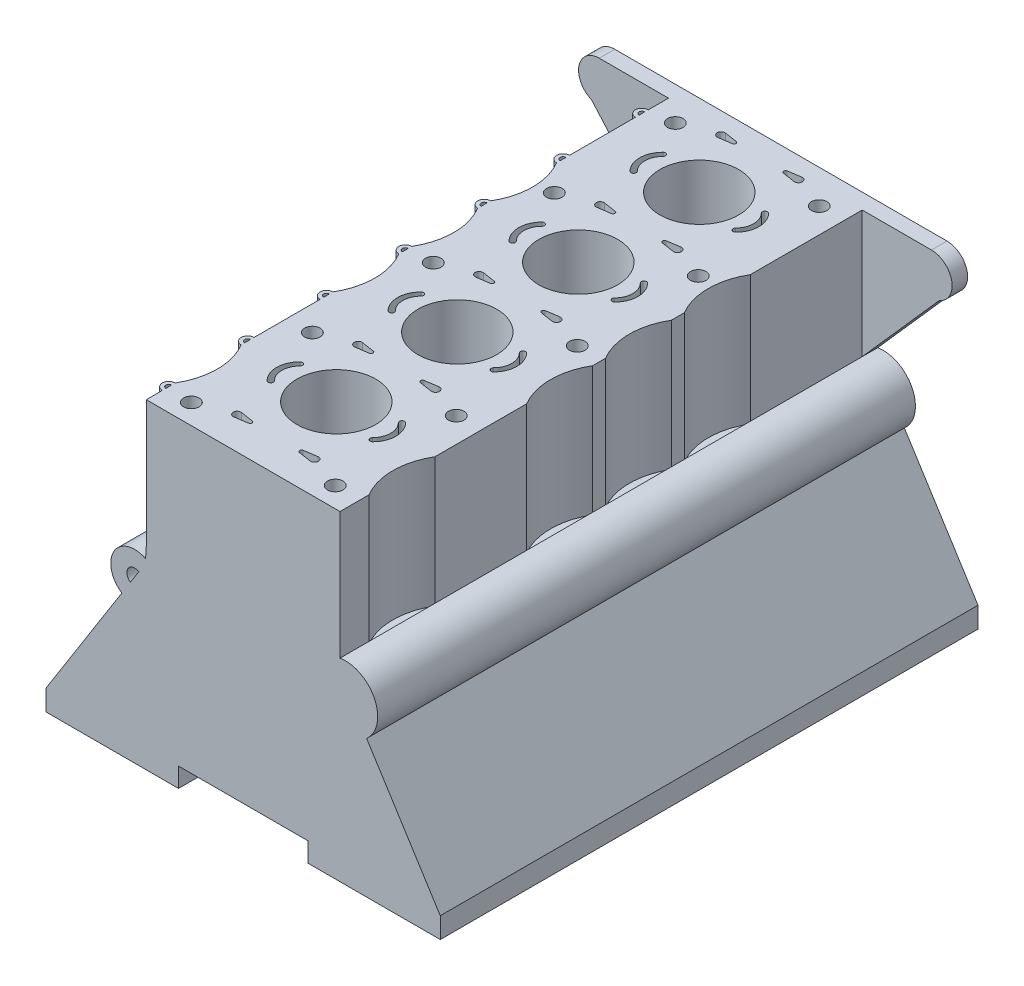
from build123d import *

# Parameters (mm, degrees)
BOSS_EXTRUDE1_DEPTH  = 12
BOSS_EXTRUDE2_DEPTH  = 404
SKETCH3_R            = 30.5
SKETCH3_R_2          = 6
CUT_EXTRUDE1_DEPTH   = 25
SKETCH4_R            = 5
SKETCH4_R_2          = 2.25
BOSS_EXTRUDE3_DEPTH  = 100
CUT_EXTRUDE2_DEPTH   = 100
BOSS_EXTRUDE6_DEPTH  = 12
SKETCH9_R            = 12.5
SKETCH9_R_2          = 5
BOSS_EXTRUDE7_DEPTH  = 346
SKETCH10_R           = 5
CUT_EXTRUDE5_DEPTH   = 346
SKETCH12_R           = 18.5
SKETCH12_R_2         = 6
BOSS_EXTRUDE8_DEPTH  = 150
SKETCH14_W           = 35
SKETCH14_H           = 75
BOSS_EXTRUDE10_DEPTH = 80
CHAMFER3_SIZE        = 24
SKETCH16_R           = 30.5
CUT_EXTRUDE7_DEPTH   = 508.756093021
SKETCH17_W           = 188
SKETCH17_H           = 64
CUT_EXTRUDE8_DEPTH   = 130
BOSS_EXTRUDE11_START = -200
SKETCH18_R           = 18.5
SKETCH18_R_2         = 6
BOSS_EXTRUDE11_DEPTH = 216
BOSS_EXTRUDE12_DEPTH = 416
SKETCH20_W           = 100
SKETCH20_H           = 30
CUT_EXTRUDE9_DEPTH   = 472.985974005


with BuildPart() as part:
    # Sketch1 → Boss-Extrude1 (new body)
    with BuildSketch(Plane.XY):
        with BuildLine():
            Line((128.5, 162.660719366), (-128.5, 162.660719366))
            ThreePointArc((-128.5, 162.660719366), (-144.199090504, 149.749174859), (-134.560742788, 131.853039032))
            Line((-134.560742788, 131.853039032), (-74.940487045, 64.433271122))
            Line((-74.940487045, 64.433271122), (-75.675832105, 52.455822827))
            Line((-75.675832105, 52.455822827), (-152.5, -69.339280634))
            Line((-152.5, -69.339280634), (-152.5, -85.339280634))
            Line((-152.5, -85.339280634), (152.5, -85.339280634))
            Line((152.5, -85.339280634), (152.5, -69.339280634))
            Line((152.5, -69.339280634), (75.675832105, 52.455822827))
            Line((75.675832105, 52.455822827), (74.940487045, 64.433271122))
            Line((74.940487045, 64.433271122), (134.560742788, 131.853039032))
            ThreePointArc((134.560742788, 131.853039032), (144.199090504, 149.749174859), (128.5, 162.660719366))
        make_face()
    extrude(amount=BOSS_EXTRUDE1_DEPTH)

    # Sketch2 → Boss-Extrude2 (add)
    with BuildSketch(Plane.XY.offset(12)):
        Polygon((-74.940487045, 64.433271122), (-74.940487045, 162.660719366), (74.940487045, 162.660719366), (74.940487045, 64.433271122), (75.675832105, 52.455822827), (152.5, -69.339280634), (152.5, -85.339280634), (-152.5, -85.339280634), (-152.5, -69.339280634), (-75.675832105, 52.455822827), align=None)
    extrude(amount=BOSS_EXTRUDE2_DEPTH)

    # Sketch3 → Cut-Extrude1 (cut)
    with BuildSketch(Plane(origin=(0, 162.660719366, 0), x_dir=(1, 0, 0), z_dir=(0, 1, 0))):
        with Locations(Location((0, -63.1, 0), (0, 0, 270))):
            Circle(SKETCH3_R)
        with Locations(Location((-55.675832105, -26, 0), (0, 0, 270))):
            Circle(SKETCH3_R_2)
        with Locations(Location((55.675832105, -26, 0), (0, 0, 90))):
            Circle(SKETCH3_R_2)
        with Locations(Location((0, -156.7, 0), (0, 0, 270))):
            Circle(SKETCH3_R)
        with Locations(Location((55.675832105, -119.6, 0), (0, 0, 90))):
            Circle(SKETCH3_R_2)
        with Locations(Location((-55.675832105, -119.6, 0), (0, 0, 270))):
            Circle(SKETCH3_R_2)
        with Locations(Location((0, -250.3, 0), (0, 0, 270))):
            Circle(SKETCH3_R)
        with Locations(Location((55.675832105, -213.2, 0), (0, 0, 90))):
            Circle(SKETCH3_R_2)
        with Locations(Location((-55.675832105, -213.2, 0), (0, 0, 270))):
            Circle(SKETCH3_R_2)
        with Locations(Location((0, -343.9, 0), (0, 0, 270))):
            Circle(SKETCH3_R)
        with Locations(Location((55.675832105, -306.8, 0), (0, 0, 90))):
            Circle(SKETCH3_R_2)
        with Locations(Location((-55.675832105, -306.8, 0), (0, 0, 270))):
            Circle(SKETCH3_R_2)
        with Locations(Location((-55.675832105, -400.4, 0), (0, 0, 270))):
            Circle(SKETCH3_R_2)
        with Locations(Location((55.675832105, -400.4, 0), (0, 0, 90))):
            Circle(SKETCH3_R_2)
        with BuildLine():
            Line((-29.490487045, -200.53394201), (-19.715487045, -202.016971005))
            ThreePointArc((-19.715487045, -202.016971005), (-18.440487045, -203.5), (-19.715487045, -204.983028995))
            Line((-19.715487045, -204.983028995), (-29.490487045, -206.46605799))
            ThreePointArc((-29.490487045, -206.46605799), (-32.940487045, -203.5), (-29.490487045, -200.53394201))
        make_face()
        with BuildLine():
            Line((29.490487045, -206.46605799), (19.715487045, -204.983028995))
            ThreePointArc((19.715487045, -204.983028995), (18.440487045, -203.5), (19.715487045, -202.016971005))
            Line((19.715487045, -202.016971005), (29.490487045, -200.53394201))
            ThreePointArc((29.490487045, -200.53394201), (32.940487045, -203.5), (29.490487045, -206.46605799))
        make_face()
        with BuildLine():
            Line((-29.490487045, -106.93394201), (-19.715487045, -108.416971005))
            ThreePointArc((-19.715487045, -108.416971005), (-18.440487045, -109.9), (-19.715487045, -111.383028995))
            Line((-19.715487045, -111.383028995), (-29.490487045, -112.86605799))
            ThreePointArc((-29.490487045, -112.86605799), (-32.940487045, -109.9), (-29.490487045, -106.93394201))
        make_face()
        with BuildLine():
            Line((29.490487045, -112.86605799), (19.715487045, -111.383028995))
            ThreePointArc((19.715487045, -111.383028995), (18.440487045, -109.9), (19.715487045, -108.416971005))
            Line((19.715487045, -108.416971005), (29.490487045, -106.93394201))
            ThreePointArc((29.490487045, -106.93394201), (32.940487045, -109.9), (29.490487045, -112.86605799))
        make_face()
        with BuildLine():
            Line((-29.490487045, -13.33394201), (-19.715487045, -14.816971005))
            ThreePointArc((-19.715487045, -14.816971005), (-18.440487045, -16.3), (-19.715487045, -17.783028995))
            Line((-19.715487045, -17.783028995), (-29.490487045, -19.26605799))
            ThreePointArc((-29.490487045, -19.26605799), (-32.940487045, -16.3), (-29.490487045, -13.33394201))
        make_face()
        with BuildLine():
            Line((29.490487045, -19.26605799), (19.715487045, -17.783028995))
            ThreePointArc((19.715487045, -17.783028995), (18.440487045, -16.3), (19.715487045, -14.816971005))
            Line((19.715487045, -14.816971005), (29.490487045, -13.33394201))
            ThreePointArc((29.490487045, -13.33394201), (32.940487045, -16.3), (29.490487045, -19.26605799))
        make_face()
        with BuildLine():
            Line((-29.490487045, -294.13394201), (-19.715487045, -295.616971005))
            ThreePointArc((-19.715487045, -295.616971005), (-18.440487045, -297.1), (-19.715487045, -298.583028995))
            Line((-19.715487045, -298.583028995), (-29.490487045, -300.06605799))
            ThreePointArc((-29.490487045, -300.06605799), (-32.940487045, -297.1), (-29.490487045, -294.13394201))
        make_face()
        with BuildLine():
            Line((29.490487045, -300.06605799), (19.715487045, -298.583028995))
            ThreePointArc((19.715487045, -298.583028995), (18.440487045, -297.1), (19.715487045, -295.616971005))
            Line((19.715487045, -295.616971005), (29.490487045, -294.13394201))
            ThreePointArc((29.490487045, -294.13394201), (32.940487045, -297.1), (29.490487045, -300.06605799))
        make_face()
        with BuildLine():
            Line((-29.490487045, -387.73394201), (-19.715487045, -389.216971005))
            ThreePointArc((-19.715487045, -389.216971005), (-18.440487045, -390.7), (-19.715487045, -392.183028995))
            Line((-19.715487045, -392.183028995), (-29.490487045, -393.66605799))
            ThreePointArc((-29.490487045, -393.66605799), (-32.940487045, -390.7), (-29.490487045, -387.73394201))
        make_face()
        with BuildLine():
            Line((29.490487045, -393.66605799), (19.715487045, -392.183028995))
            ThreePointArc((19.715487045, -392.183028995), (18.440487045, -390.7), (19.715487045, -389.216971005))
            Line((19.715487045, -389.216971005), (29.490487045, -387.73394201))
            ThreePointArc((29.490487045, -387.73394201), (32.940487045, -390.7), (29.490487045, -393.66605799))
        make_face()
        with BuildLine():
            ThreePointArc((-40.874213142, -50.372077939), (-46.146291081, -63.1), (-40.874213142, -75.827922061))
            ThreePointArc((-40.874213142, -75.827922061), (-38.045786017, -75.827922061), (-38.045786017, -72.999494937))
            ThreePointArc((-38.045786017, -72.999494937), (-42.146291081, -63.1), (-38.045786017, -53.200505063))
            ThreePointArc((-38.045786017, -53.200505063), (-38.045786017, -50.372077939), (-40.874213142, -50.372077939))
        make_face()
        with BuildLine():
            ThreePointArc((40.874213142, -50.372077939), (46.146291081, -63.1), (40.874213142, -75.827922061))
            ThreePointArc((40.874213142, -75.827922061), (38.045786017, -75.827922061), (38.045786017, -72.999494937))
            ThreePointArc((38.045786017, -72.999494937), (42.146291081, -63.1), (38.045786017, -53.200505063))
            ThreePointArc((38.045786017, -53.200505063), (38.045786017, -50.372077939), (40.874213142, -50.372077939))
        make_face()
        with BuildLine():
            ThreePointArc((-40.874213142, -143.972077939), (-46.146291081, -156.7), (-40.874213142, -169.427922061))
            ThreePointArc((-40.874213142, -169.427922061), (-38.045786017, -169.427922061), (-38.045786017, -166.599494937))
            ThreePointArc((-38.045786017, -166.599494937), (-42.146291081, -156.7), (-38.045786017, -146.800505063))
            ThreePointArc((-38.045786017, -146.800505063), (-38.045786017, -143.972077939), (-40.874213142, -143.972077939))
        make_face()
        with BuildLine():
            ThreePointArc((40.874213142, -143.972077939), (46.146291081, -156.7), (40.874213142, -169.427922061))
            ThreePointArc((40.874213142, -169.427922061), (38.045786017, -169.427922061), (38.045786017, -166.599494937))
            ThreePointArc((38.045786017, -166.599494937), (42.146291081, -156.7), (38.045786017, -146.800505063))
            ThreePointArc((38.045786017, -146.800505063), (38.045786017, -143.972077939), (40.874213142, -143.972077939))
        make_face()
        with BuildLine():
            ThreePointArc((-40.874213142, -237.572077939), (-46.146291081, -250.3), (-40.874213142, -263.027922061))
            ThreePointArc((-40.874213142, -263.027922061), (-38.045786017, -263.027922061), (-38.045786017, -260.199494937))
            ThreePointArc((-38.045786017, -260.199494937), (-42.146291081, -250.3), (-38.045786017, -240.400505063))
            ThreePointArc((-38.045786017, -240.400505063), (-38.045786017, -237.572077939), (-40.874213142, -237.572077939))
        make_face()
        with BuildLine():
            ThreePointArc((40.874213142, -237.572077939), (46.146291081, -250.3), (40.874213142, -263.027922061))
            ThreePointArc((40.874213142, -263.027922061), (38.045786017, -263.027922061), (38.045786017, -260.199494937))
            ThreePointArc((38.045786017, -260.199494937), (42.146291081, -250.3), (38.045786017, -240.400505063))
            ThreePointArc((38.045786017, -240.400505063), (38.045786017, -237.572077939), (40.874213142, -237.572077939))
        make_face()
        with BuildLine():
            ThreePointArc((-40.874213142, -331.172077939), (-46.146291081, -343.9), (-40.874213142, -356.627922061))
            ThreePointArc((-40.874213142, -356.627922061), (-38.045786017, -356.627922061), (-38.045786017, -353.799494937))
            ThreePointArc((-38.045786017, -353.799494937), (-42.146291081, -343.9), (-38.045786017, -334.000505063))
            ThreePointArc((-38.045786017, -334.000505063), (-38.045786017, -331.172077939), (-40.874213142, -331.172077939))
        make_face()
        with BuildLine():
            ThreePointArc((40.874213142, -331.172077939), (46.146291081, -343.9), (40.874213142, -356.627922061))
            ThreePointArc((40.874213142, -356.627922061), (38.045786017, -356.627922061), (38.045786017, -353.799494937))
            ThreePointArc((38.045786017, -353.799494937), (42.146291081, -343.9), (38.045786017, -334.000505063))
            ThreePointArc((38.045786017, -334.000505063), (38.045786017, -331.172077939), (40.874213142, -331.172077939))
        make_face()
    extrude(amount=-CUT_EXTRUDE1_DEPTH, mode=Mode.SUBTRACT)

    # Sketch4 → Boss-Extrude3 (add)
    # profile 1 of 7: a face of its own
    with BuildSketch(Plane(origin=(0, 162.660719366, 0), x_dir=(1, 0, 0), z_dir=(0, 1, 0))):
        with Locations((-74.940487045, -32.6)):
            Circle(SKETCH4_R)
        with Locations((-74.940487045, -32.6)):
            Circle(SKETCH4_R_2, mode=Mode.SUBTRACT)
    # profile 2 of 7: a face of its own
    with BuildSketch(Plane(origin=(0, 162.660719366, 0), x_dir=(1, 0, 0), z_dir=(0, 1, 0))):
        with Locations((-74.940487045, -93.6)):
            Circle(SKETCH4_R)
        with Locations((-74.940487045, -93.6)):
            Circle(SKETCH4_R_2, mode=Mode.SUBTRACT)
    # profile 3 of 7: a face of its own
    with BuildSketch(Plane(origin=(0, 162.660719366, 0), x_dir=(1, 0, 0), z_dir=(0, 1, 0))):
        with Locations((-74.940487045, -154.6)):
            Circle(SKETCH4_R)
        with Locations((-74.940487045, -154.6)):
            Circle(SKETCH4_R_2, mode=Mode.SUBTRACT)
    # profile 4 of 7: a face of its own
    with BuildSketch(Plane(origin=(0, 162.660719366, 0), x_dir=(1, 0, 0), z_dir=(0, 1, 0))):
        with Locations((-74.940487045, -215.6)):
            Circle(SKETCH4_R)
        with Locations((-74.940487045, -215.6)):
            Circle(SKETCH4_R_2, mode=Mode.SUBTRACT)
    # profile 5 of 7: a face of its own
    with BuildSketch(Plane(origin=(0, 162.660719366, 0), x_dir=(1, 0, 0), z_dir=(0, 1, 0))):
        with Locations((-74.940487045, -276.6)):
            Circle(SKETCH4_R)
        with Locations((-74.940487045, -276.6)):
            Circle(SKETCH4_R_2, mode=Mode.SUBTRACT)
    # profile 6 of 7: a face of its own
    with BuildSketch(Plane(origin=(0, 162.660719366, 0), x_dir=(1, 0, 0), z_dir=(0, 1, 0))):
        with Locations((-74.940487045, -337.6)):
            Circle(SKETCH4_R)
        with Locations((-74.940487045, -337.6)):
            Circle(SKETCH4_R_2, mode=Mode.SUBTRACT)
    # profile 7 of 7: a face of its own
    with BuildSketch(Plane(origin=(0, 162.660719366, 0), x_dir=(1, 0, 0), z_dir=(0, 1, 0))):
        with Locations((-74.940487045, -398.6)):
            Circle(SKETCH4_R)
        with Locations((-74.940487045, -398.6)):
            Circle(SKETCH4_R_2, mode=Mode.SUBTRACT)
    extrude(amount=-BOSS_EXTRUDE3_DEPTH)

    # Sketch5 → Cut-Extrude2 (cut)
    with BuildSketch(Plane(origin=(0, 162.660719366, 0), x_dir=(1, 0, 0), z_dir=(0, 1, 0))):
        with BuildLine():
            Line((-74.940487045, -342.6), (-74.940487045, -393.6))
            ThreePointArc((-74.940487045, -393.6), (-67.949207091, -368.1), (-74.940487045, -342.6))
        make_face()
        with BuildLine():
            Line((-74.940487045, -220.6), (-74.940487045, -271.6))
            ThreePointArc((-74.940487045, -271.6), (-67.949207091, -246.1), (-74.940487045, -220.6))
        make_face()
        with BuildLine():
            Line((74.940487045, -342.6), (74.940487045, -393.6))
            ThreePointArc((74.940487045, -393.6), (67.949207091, -368.1), (74.940487045, -342.6))
        make_face()
        with BuildLine():
            Line((74.940487045, -220.6), (74.940487045, -271.6))
            ThreePointArc((74.940487045, -271.6), (67.949207091, -246.1), (74.940487045, -220.6))
        make_face()
        with BuildLine():
            Line((-74.940487045, -159.6), (-74.940487045, -210.6))
            ThreePointArc((-74.940487045, -210.6), (-67.949207091, -185.1), (-74.940487045, -159.6))
        make_face()
        with BuildLine():
            Line((74.940487045, -159.6), (74.940487045, -210.6))
            ThreePointArc((74.940487045, -210.6), (67.949207091, -185.1), (74.940487045, -159.6))
        make_face()
        with BuildLine():
            Line((-74.940487045, -98.6), (-74.940487045, -149.6))
            ThreePointArc((-74.940487045, -149.6), (-67.949207091, -124.1), (-74.940487045, -98.6))
        make_face()
        with BuildLine():
            Line((74.940487045, -98.6), (74.940487045, -149.6))
            ThreePointArc((74.940487045, -149.6), (67.949207091, -124.1), (74.940487045, -98.6))
        make_face()
    extrude(amount=-CUT_EXTRUDE2_DEPTH, mode=Mode.SUBTRACT)

    # Sketch6 → Boss-Extrude6 (add)
    with BuildSketch(Plane(origin=(0, 0, 0), x_dir=(-1, 0, 0), z_dir=(0, 0, -1))):
        Polygon((72.536528532, 100.660719366), (25.771156727, 100.660719366), (2.388470825, 60.160719366), (25.771156727, 19.660719366), (72.536528532, 19.660719366), (95.919214434, 60.160719366), align=None)
    extrude(amount=-BOSS_EXTRUDE6_DEPTH)

    # Sketch9 → Boss-Extrude7 (add)
    with BuildSketch(Plane(origin=(0, 0, 0), x_dir=(-1, 0, 0), z_dir=(0, 0, -1))):
        with Locations((78.177370172, 61.660719366)):
            Circle(SKETCH9_R)
        with Locations((78.177370172, 61.660719366)):
            Circle(SKETCH9_R_2, mode=Mode.SUBTRACT)
    extrude(amount=-BOSS_EXTRUDE7_DEPTH)

    # Sketch10 → Cut-Extrude5 (cut)
    with BuildSketch(Plane(origin=(0, 0, 0), x_dir=(-1, 0, 0), z_dir=(0, 0, -1))):
        with Locations((78.177370172, 61.660719366)):
            Circle(SKETCH10_R)
    extrude(amount=-CUT_EXTRUDE5_DEPTH, mode=Mode.SUBTRACT)

    # Sketch12 → Boss-Extrude8 (add)
    with BuildSketch(Plane(origin=(0, 0, 0), x_dir=(-1, 0, 0), z_dir=(0, 0, -1))):
        with Locations((83.922488704, 39.381780878)):
            Circle(SKETCH12_R)
        with Locations((83.922488704, 39.381780878)):
            Circle(SKETCH12_R_2, mode=Mode.SUBTRACT)
    extrude(amount=-BOSS_EXTRUDE8_DEPTH)

    # Sketch14 → Boss-Extrude10 (add)
    with BuildSketch(Plane(origin=(0, 78, 0), x_dir=(1, 0, 0), z_dir=(0, 1, 0))):
        with Locations((-86.440487045, -174.5)):
            Rectangle(SKETCH14_W, SKETCH14_H)
    extrude(amount=-BOSS_EXTRUDE10_DEPTH)

    # Chamfer3
    chamfer3_edges = [part.edges().sort_by_distance(p)[0] for p in [
        (-103.940487045, 78, 174.5),
    ]]
    chamfer(chamfer3_edges, length=CHAMFER3_SIZE - 0.0001)  # a hair under: the kernel refuses the full size

    # Sketch16 → Cut-Extrude7 (cut, through all)
    with BuildSketch(Plane(origin=(0, 162.660719366, 0), x_dir=(1, 0, 0), z_dir=(0, 1, 0))):
        with Locations(Location((0, -343.9, 0), (0, 0, 270))):
            Circle(SKETCH16_R)
        with Locations(Location((0, -250.3, 0), (0, 0, 270))):
            Circle(SKETCH16_R)
        with Locations(Location((0, -156.7, 0), (0, 0, 270))):
            Circle(SKETCH16_R)
        with Locations(Location((0, -63.1, 0), (0, 0, 270))):
            Circle(SKETCH16_R)
    extrude(amount=-CUT_EXTRUDE7_DEPTH, mode=Mode.SUBTRACT)

    # Sketch17 → Cut-Extrude8 (cut)
    with BuildSketch(Plane.XZ.offset(85.339280634)):
        with Locations((0, 156.7)):
            Rectangle(SKETCH17_W, SKETCH17_H)
        with Locations((0, 63.1)):
            Rectangle(SKETCH17_W, SKETCH17_H)
        with Locations((0, 250.3)):
            Rectangle(SKETCH17_W, SKETCH17_H)
        with Locations((0, 343.9)):
            Rectangle(SKETCH17_W, SKETCH17_H)
    extrude(amount=-CUT_EXTRUDE8_DEPTH, mode=Mode.SUBTRACT)

    # Sketch18 → Boss-Extrude11 (add)
    with BuildSketch(Plane(origin=(0, 0, 0), x_dir=(-1, 0, 0), z_dir=(0, 0, -1)).offset(BOSS_EXTRUDE11_START)):
        with Locations((83.922488704, 39.381780878)):
            Circle(SKETCH18_R)
        with Locations(Location((83.922488704, 39.381780878, 0), (0, 0, 302.242321169))):
            Circle(SKETCH18_R_2, mode=Mode.SUBTRACT)
    extrude(amount=-BOSS_EXTRUDE11_DEPTH)

    # Sketch19 → Boss-Extrude12 (add)
    with BuildSketch(Plane.XY.offset(416)):
        with BuildLine():
            Line((74.940487045, 64.433271122), (75.675832105, 52.455822827))
            Line((75.675832105, 52.455822827), (95.544803704, 20.956055008))
            ThreePointArc((95.544803704, 20.956055008), (101.68535009, 50.487036288), (74.940487045, 64.433271122))
        make_face()
    extrude(amount=-BOSS_EXTRUDE12_DEPTH)

    # Sketch20 → Cut-Extrude9 (cut, through all)
    with BuildSketch(Plane.XY.offset(416)):
        with Locations((0, -85.339280634)):
            Rectangle(SKETCH20_W, SKETCH20_H)
    extrude(amount=-CUT_EXTRUDE9_DEPTH, mode=Mode.SUBTRACT)


solid = part.part
